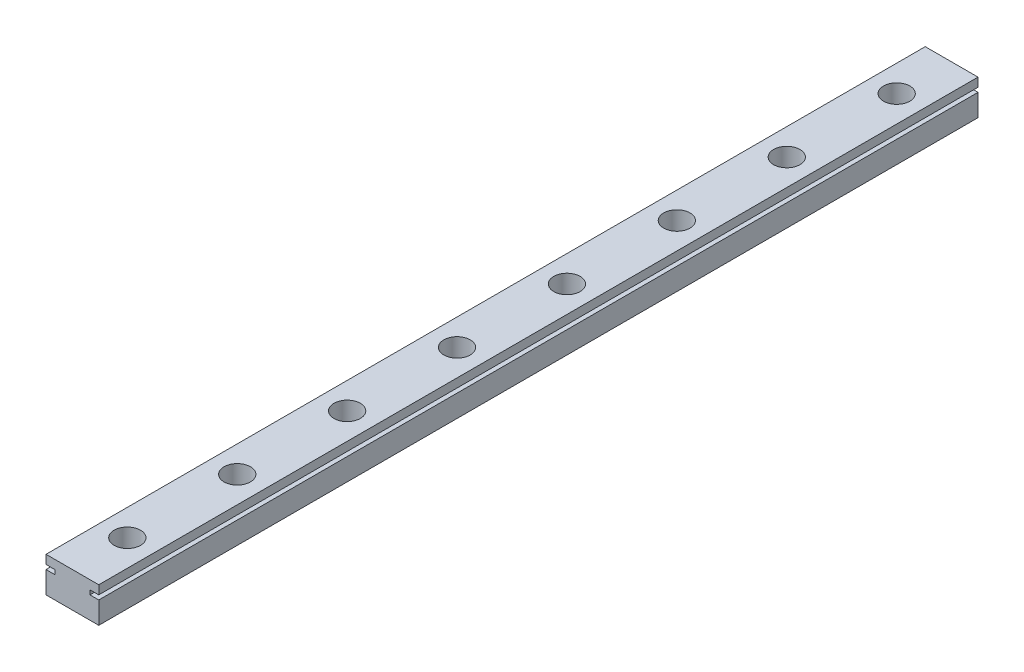
from build123d import *

# Parameters (mm, degrees)
BOSS_EXTRU_1_DEPTH         = 100
PER_AGEAVANC_1_START       = -1
PER_AGEAVANC_1_OUTLINE_R   = 3
PER_AGEAVANC_1_DEPTH       = 5
PER_AGEAVANC_1_START_2     = -4
PER_AGEAVANC_1_2_OUTLINE_R = 1.7
PER_AGEAVANC_1_2_DEPTH     = 3


# Read off the part's stored shape, not the designer's step: PerçageAvancé1
with BuildPart() as part:
    # Esquisse1 → Boss.-Extru.1 (new, symmetric)
    with BuildSketch(Plane.XY):
        Polygon((6, 2), (6, 4), (-6, 4), (-6, 2), (-4, 2), (-4, 1), (-6, 1), (-6, -4), (6, -4), (6, 1), (4, 1), (4, 2), align=None)
    extrude(amount=BOSS_EXTRU_1_DEPTH, both=True)

    # PerçageAvancé1 outline → PerçageAvancé1 (cut)
    with BuildSketch(Plane(origin=(0, 0, 0), x_dir=(1, 0, 0), z_dir=(0, 1, 0)).offset(PER_AGEAVANC_1_START)):
        with Locations((0, -87.5)):
            Circle(PER_AGEAVANC_1_OUTLINE_R)
        with Locations((0, -62.5)):
            Circle(PER_AGEAVANC_1_OUTLINE_R)
        with Locations((0, -37.5)):
            Circle(PER_AGEAVANC_1_OUTLINE_R)
        with Locations((0, -12.5)):
            Circle(PER_AGEAVANC_1_OUTLINE_R)
        with Locations((0, 12.5)):
            Circle(PER_AGEAVANC_1_OUTLINE_R)
        with Locations((0, 87.5)):
            Circle(PER_AGEAVANC_1_OUTLINE_R)
        with Locations((0, 62.5)):
            Circle(PER_AGEAVANC_1_OUTLINE_R)
        with Locations((0, 37.5)):
            Circle(PER_AGEAVANC_1_OUTLINE_R)
    extrude(amount=PER_AGEAVANC_1_DEPTH, mode=Mode.SUBTRACT)

    # Per_ageAvanc_1 2 outline → Per_ageAvanc_1 2 (cut)
    with BuildSketch(Plane(origin=(0, 0, 0), x_dir=(1, 0, 0), z_dir=(0, 1, 0)).offset(PER_AGEAVANC_1_START_2)):
        with Locations((0, -87.5)):
            Circle(PER_AGEAVANC_1_2_OUTLINE_R)
        with Locations((0, -62.5)):
            Circle(PER_AGEAVANC_1_2_OUTLINE_R)
        with Locations((0, -37.5)):
            Circle(PER_AGEAVANC_1_2_OUTLINE_R)
        with Locations((0, -12.5)):
            Circle(PER_AGEAVANC_1_2_OUTLINE_R)
        with Locations((0, 12.5)):
            Circle(PER_AGEAVANC_1_2_OUTLINE_R)
        with Locations((0, 87.5)):
            Circle(PER_AGEAVANC_1_2_OUTLINE_R)
        with Locations((0, 62.5)):
            Circle(PER_AGEAVANC_1_2_OUTLINE_R)
        with Locations((0, 37.5)):
            Circle(PER_AGEAVANC_1_2_OUTLINE_R)
    extrude(amount=PER_AGEAVANC_1_2_DEPTH, mode=Mode.SUBTRACT)


solid = part.part
